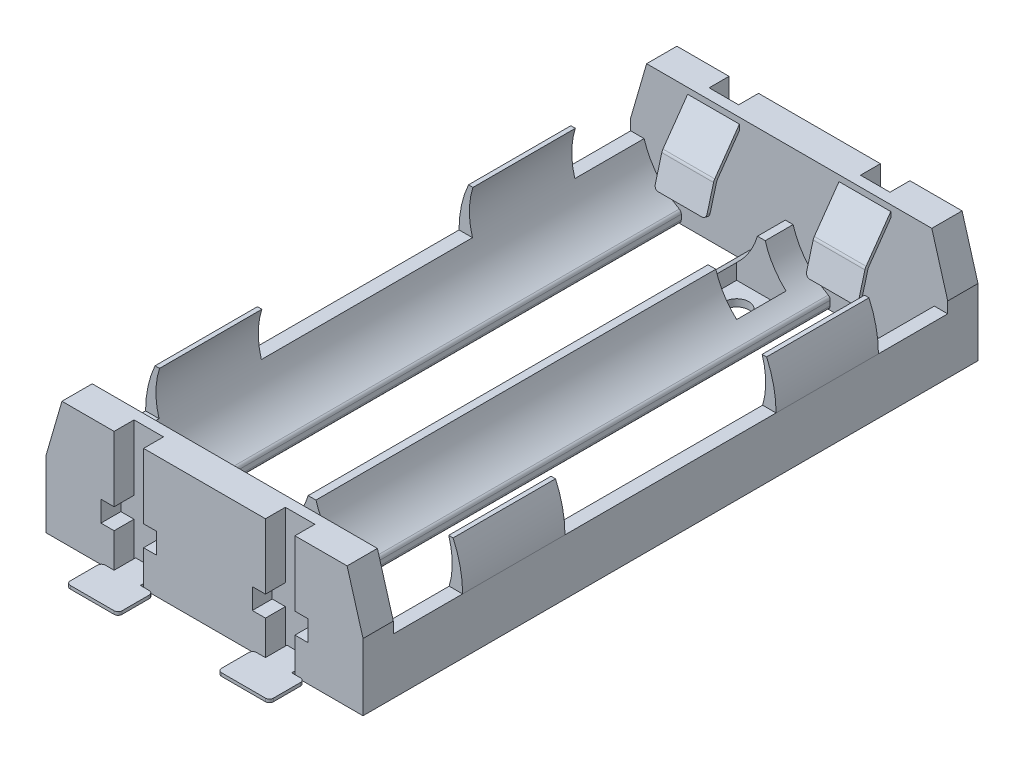
from build123d import *

# Parameters (mm, degrees)
P_IDAT_VYSUNUT_M1_DEPTH       = 3.8
P_IDAT_VYSUNUT_M2_DEPTH       = 77.2
P_IDAT_START                  = 73.4
P_IDAT_VYSUNUT_M3_DEPTH       = 3.8
ODEBRAT_VYSUNUT_M1_DEPTH      = 81.305494831
ODEBRAT_VYSUNUT_M1_DEPTH_BACK = 81.305494831
SKICA2_W                      = 66.391308427
SKICA2_H                      = 41.660555381
SKICA3_W                      = 13.005504782
SKICA3_H                      = 14.493696871
SKICA3_W_2                    = 51.892611119
SKICA3_H_2                    = 11.840832711
ODEBRAT_VYSUNUT_M2_DEPTH      = 34.8
SKICA4_W                      = 8.7
SKICA4_H                      = 8.3
SKICA4_W_2                    = 15.223310866
SKICA4_H_2                    = 13.805688468
ODEBRAT_VYSUNUT_M3_DEPTH      = 57.277193427
ODEBRAT_VYSUNUT_M4_DEPTH      = 21.55
P_IDAT_VYSUNUT_M4_DEPTH       = 12.85
SKICA6_W                      = 3.7
SKICA6_H                      = 15.3
SKICA6_W_2                    = 7
SKICA6_H_2                    = 2.6
ODEBRAT_VYSUNUT_M5_DEPTH      = 2.5
SKICA7_W                      = 1.65
SKICA7_H                      = 2.7
P_IDAT_VYSUNUT_M5_DEPTH       = 0.4
ZAOBLIT1_R                    = 0.2
P_IDAT_VYSUNUT_M6_DEPTH       = 3.25
ZAOBLIT2_R                    = 0.5
ZAOBLIT3_R                    = 1
ZAOBLIT4_R                    = 0.5
ODEBRAT_VYSUNUT_M6_DEPTH      = 34.8
ZAOBLIT5_R                    = 0.5
ODEBRAT_VYSUNUT_M7_DEPTH      = 45.213798751
ODEBRAT_VYSUNUT_M7_DEPTH_BACK = 45.213798751
SKICA10_R                     = 1.55
SKICA10_4_W                   = 6.2
SKICA10_4_H                   = 6.2
SKICA10_4_R                   = 1.55
ODEBRAT_VYSUNUT_M8_DEPTH      = 6.1


with BuildPart() as part:
    # Skica1 → Přidat vysunutím1 (new body)
    with BuildSketch(Plane.XY):
        Polygon((-17.9, 5.65), (-19.9, -1.25), (-19.9, -9.65), (19.9, -9.65), (19.9, -1.25), (17.9, 5.65), align=None)
    extrude(amount=P_IDAT_VYSUNUT_M1_DEPTH)

    # Skica1<3> → Přidat vysunutím2 (add)
    with BuildSketch(Plane.XY):
        with BuildLine():
            Line((-16.673933369, 5.65), (-17.9, 5.65))
            Line((-17.9, 5.65), (-19.9, -1.25))
            Line((-19.9, -1.25), (-19.9, -9.65))
            Line((-19.9, -9.65), (19.9, -9.65))
            Line((19.9, -9.65), (19.9, -1.25))
            Line((19.9, -1.25), (17.9, 5.65))
            Line((17.9, 5.65), (16.673933369, 5.65))
            ThreePointArc((16.673933369, 5.65), (18.105252243, 2.984637024), (18.6, 0))
            ThreePointArc((18.6, 0), (6.365362976, -8.755252243), (2.026066631, 5.65))
            Line((2.026066631, 5.65), (-2.026066631, 5.65))
            ThreePointArc((-2.026066631, 5.65), (-0.594747757, 2.984637024), (-0.1, 0))
            ThreePointArc((-0.1, 0), (-12.334637024, -8.755252243), (-16.673933369, 5.65))
        make_face()
    extrude(amount=P_IDAT_VYSUNUT_M2_DEPTH)

    # Skica1<4> → Přidat vysunutím3 (add)
    with BuildSketch(Plane.XY.offset(P_IDAT_START)):
        with BuildLine():
            Line((-2.026066631, 5.65), (-16.673933369, 5.65))
            ThreePointArc((-16.673933369, 5.65), (-9.35, -9.25), (-2.026066631, 5.65))
        make_face()
        with BuildLine():
            Line((16.673933369, 5.65), (2.026066631, 5.65))
            ThreePointArc((2.026066631, 5.65), (9.35, -9.25), (16.673933369, 5.65))
        make_face()
    extrude(amount=P_IDAT_VYSUNUT_M3_DEPTH)

    # Skica2 → Odebrat vysunutím1 (cut, two sides: drawn at the far end of the back side and taken through both)
    with BuildSketch(Plane(origin=(0, 0, 0), x_dir=(1, 0, 0), z_dir=(0, 1, 0)).offset(-ODEBRAT_VYSUNUT_M1_DEPTH_BACK)):
        with Locations((-4.58841072, -59.430277691)):
            Rectangle(SKICA2_W, SKICA2_H)
    extrude(amount=ODEBRAT_VYSUNUT_M1_DEPTH + ODEBRAT_VYSUNUT_M1_DEPTH_BACK, mode=Mode.SUBTRACT)

    # Skica3 → Odebrat vysunutím2 (cut)
    with BuildSketch(Plane.XY.offset(38.6)):
        with Locations((-0.097056006, 4.596848436)):
            Rectangle(SKICA3_W, SKICA3_H)
        with Locations((2.00582412, 8.770416356)):
            Rectangle(SKICA3_W_2, SKICA3_H_2)
    extrude(amount=-ODEBRAT_VYSUNUT_M2_DEPTH, mode=Mode.SUBTRACT)

    # Skica4 → Odebrat vysunutím3 (cut, through all)
    with BuildSketch(Plane(origin=(19.9, 0, 0), x_dir=(0, 0, -1), z_dir=(1, 0, 0))):
        with Locations((-8.15, 1.5)):
            Rectangle(SKICA4_W, SKICA4_H)
        with Locations((-32.961655433, 4.252844234)):
            Rectangle(SKICA4_W_2, SKICA4_H_2)
    extrude(amount=-ODEBRAT_VYSUNUT_M3_DEPTH, mode=Mode.SUBTRACT)

    # Skica5 → Odebrat vysunutím4 (cut)
    with BuildSketch(Plane.XY.offset(25.35)):
        with BuildLine():
            ThreePointArc((19.772174517, -0.809002084), (19.868005207, -1.727284892), (19.9, -2.65))
            Line((19.9, -2.65), (19.9, -1.25))
            Line((19.9, -1.25), (19.772174517, -0.809002084))
        make_face()
    odebrat_vysunut_m4 = extrude(amount=-ODEBRAT_VYSUNUT_M4_DEPTH, mode=Mode.SUBTRACT)

    # Skica5<3> → Přidat vysunutím4 (add)
    with BuildSketch(Plane.XY.offset(25.35)):
        with BuildLine():
            ThreePointArc((19.772174517, -0.809002084), (19.373359138, 1.058607589), (18.711594203, 2.85))
            Line((18.711594203, 2.85), (19.772174517, -0.809002084))
        make_face()
    p_idat_vysunut_m4 = extrude(amount=-P_IDAT_VYSUNUT_M4_DEPTH)

    # Zrcadlit1: Odebrat vysunutím4, Přidat vysunutím4 across plane
    add(odebrat_vysunut_m4.mirror(Plane(origin=(0, 0, 0), x_dir=(0, 0, 1), z_dir=(1, 0, 0))), mode=Mode.SUBTRACT)
    add(p_idat_vysunut_m4.mirror(Plane(origin=(0, 0, 0), x_dir=(0, 0, 1), z_dir=(1, 0, 0))))

    # Skica6 → Odebrat vysunutím5 (cut)
    with BuildSketch(Plane(origin=(0, 0, 0), x_dir=(-1, 0, 0), z_dir=(0, 0, -1))):
        with Locations((-9.5, -2)):
            Rectangle(SKICA6_W, SKICA6_H)
        with Locations((-9.5, -3.85)):
            Rectangle(SKICA6_W_2, SKICA6_H_2)
        with Locations((9.5, -3.85)):
            Rectangle(SKICA6_W_2, SKICA6_H_2)
        with Locations((9.5, -2)):
            Rectangle(SKICA6_W, SKICA6_H)
    extrude(amount=-ODEBRAT_VYSUNUT_M5_DEPTH, mode=Mode.SUBTRACT)


with BuildPart() as body_2:
    # Skica7 → Přidat vysunutím5 (new body)
    with BuildSketch(Plane.XZ.offset(9.65)):
        with Locations((8.675, 1.15)):
            Rectangle(SKICA7_W, SKICA7_H)
        with Locations((10.325, 1.15)):
            Rectangle(SKICA7_W, SKICA7_H)
        Polygon((9.5, -4.6), (9.5, -0.2), (7.85, -0.2), (6.25, -0.2), (6.25, -4.6), align=None)
        Polygon((12.75, -0.2), (11.15, -0.2), (9.5, -0.2), (9.5, -4.6), (12.75, -4.6), align=None)
    extrude(amount=-P_IDAT_VYSUNUT_M5_DEPTH)

    # Zaoblit1
    zaoblit1_edges = [body_2.edges().sort_by_distance(p)[0] for p in [
        (9.5, -9.65, 2.5),
    ]]
    fillet(zaoblit1_edges, radius=ZAOBLIT1_R)

    # Kombinovat3: union part
    add(part.part)

    # Zrcadlit4: body 2 across plane


with BuildPart() as body_2_1:
    add(body_2.part)
    add(body_2.part.mirror(Plane(origin=(0, 0, 0), x_dir=(0, 0, 1), z_dir=(1, 0, 0))))

    # Skica8 → Přidat vysunutím6 (add, symmetric)
    with BuildSketch(Plane(origin=(9.5, 0, 0), x_dir=(0, 0, -1), z_dir=(1, 0, 0))):
        Polygon((-3.8, 4.9), (-7, 0.35), (-8, -3.35), (-7.613854643, -3.45436361), (-6.63225168, 0.177567354), (-3.8, 4.204675211), align=None)
    extrude(amount=P_IDAT_VYSUNUT_M6_DEPTH, both=True)

    # Zaoblit2
    zaoblit2_edges = [body_2_1.edges().sort_by_distance(p)[0] for p in [
        (6.25, -3.402181805, 7.806927321),
        (12.75, -3.402181805, 7.806927321),
    ]]
    fillet(zaoblit2_edges, radius=ZAOBLIT2_R)

    # Zaoblit3
    zaoblit3_edges = [body_2_1.edges().sort_by_distance(p)[0] for p in [
        (9.5, 0.35, 7),
        (9.5, 0.177567354, 6.63225168),
    ]]
    fillet(zaoblit3_edges, radius=ZAOBLIT3_R)

    # Zrcadlit5: body 2 across plane


with BuildPart() as body_2_2:
    add(body_2_1.part)
    add(body_2_1.part.mirror(Plane(origin=(0, 0, 0), x_dir=(0, 0, 1), z_dir=(1, 0, 0))))

    # Zaoblit4
    zaoblit4_edges = [body_2_2.edges().sort_by_distance(p)[0] for p in [
        (-6.25, -9.45, -4.6),
        (-6.25, -9.45, -0.2),
        (-12.75, -9.45, -0.2),
        (-12.75, -9.45, -4.6),
        (6.25, -9.45, -4.6),
        (6.25, -9.45, -0.2),
        (12.75, -9.45, -0.2),
        (12.75, -9.45, -4.6),
    ]]
    fillet(zaoblit4_edges, radius=ZAOBLIT4_R)

    # Skica9 → Odebrat vysunutím6 (cut)
    with BuildSketch(Plane.XY.offset(38.6)):
        with BuildLine():
            Line((-13.55, -9.65), (-5.15, -9.65))
            Line((-5.15, -9.65), (-5.15, -8.241510784))
            ThreePointArc((-5.15, -8.241510784), (-9.35, -9.25), (-13.55, -8.241510784))
            Line((-13.55, -8.241510784), (-13.55, -9.65))
        make_face()
        with BuildLine():
            Line((5.15, -8.241510784), (5.15, -9.65))
            Line((5.15, -9.65), (13.55, -9.65))
            Line((13.55, -9.65), (13.55, -8.241510784))
            ThreePointArc((13.55, -8.241510784), (9.35, -9.25), (5.15, -8.241510784))
        make_face()
    extrude(amount=-ODEBRAT_VYSUNUT_M6_DEPTH, mode=Mode.SUBTRACT)

    # Zaoblit5
    zaoblit5_edges = [body_2_2.edges().sort_by_distance(p)[0] for p in [
        (-5.15, -9.65, 21.2),
        (-13.55, -9.65, 21.2),
        (-13.55, -8.241510784, 21.2),
        (-5.15, -8.241510784, 21.2),
        (13.55, -9.65, 21.2),
        (5.15, -9.65, 21.2),
        (5.15, -8.241510784, 21.2),
        (13.55, -8.241510784, 21.2),
    ]]
    fillet(zaoblit5_edges, radius=ZAOBLIT5_R)

    # Skica10 → Odebrat vysunutím7 (cut, two sides: drawn at the far end of the back side and taken through both)
    with BuildSketch(Plane(origin=(0, -2.65, 0), x_dir=(1, 0, 0), z_dir=(0, 1, 0)).offset(-ODEBRAT_VYSUNUT_M7_DEPTH_BACK)):
        with Locations(Location((0, -10.4, 0), (0, 0, 180))):
            Circle(SKICA10_R)
    extrude(amount=ODEBRAT_VYSUNUT_M7_DEPTH + ODEBRAT_VYSUNUT_M7_DEPTH_BACK, mode=Mode.SUBTRACT)

    # Skica10<4> → Odebrat vysunutím8 (cut)
    with BuildSketch(Plane(origin=(0, -2.65, 0), x_dir=(1, 0, 0), z_dir=(0, 1, 0))):
        with Locations((0, -10.4)):
            Rectangle(SKICA10_4_W, SKICA10_4_H)
        with Locations(Location((0, -10.4, 0), (0, 0, 180))):
            Circle(SKICA10_4_R, mode=Mode.SUBTRACT)
    extrude(amount=-ODEBRAT_VYSUNUT_M8_DEPTH, mode=Mode.SUBTRACT)

    # Zrcadlit6: body 2 across plane


with BuildPart() as body_2_3:
    add(body_2_2.part)
    add(body_2_2.part.mirror(Plane(origin=(0, -9.65, 38.6), x_dir=(1, 0, 0), z_dir=(0, 0, -1))))


solid = body_2_3.part
